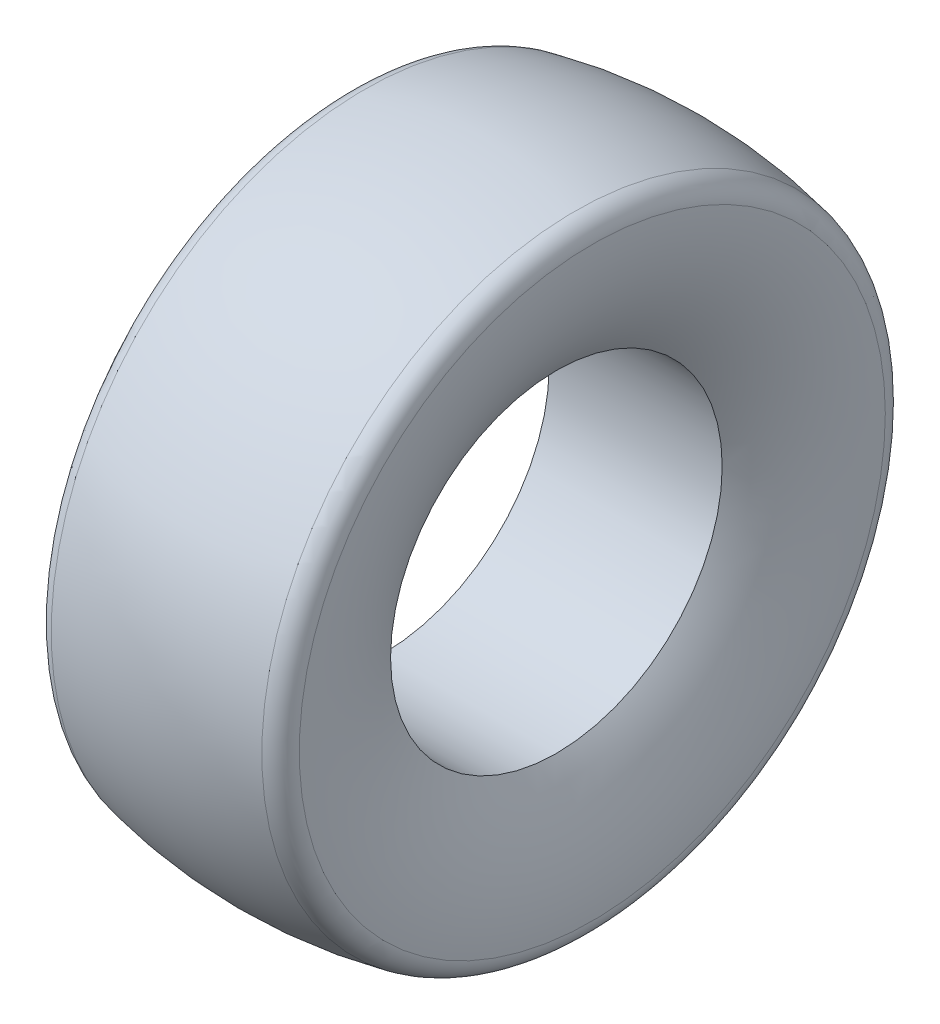
from build123d import *


with BuildPart() as part:
    # Sketch1 → Revolve1 (revolve)
    with BuildSketch(Plane.XY):
        with BuildLine():
            Line((-12, 23), (12, 23))
            ThreePointArc((12, 23), (15.882689243, 31.426850602), (16.978121166, 40.640271016))
            ThreePointArc((16.978121166, 40.640271016), (16.27586038, 42.456648811), (14.606314184, 43.459152682))
            ThreePointArc((14.606314184, 43.459152682), (7.343681374, 44.613722382), (0, 45))
            ThreePointArc((0, 45), (-7.343681374, 44.613722382), (-14.606314184, 43.459152682))
            ThreePointArc((-14.606314184, 43.459152682), (-16.27586038, 42.456648811), (-16.978121166, 40.640271016))
            ThreePointArc((-16.978121166, 40.640271016), (-15.882689243, 31.426850602), (-12, 23))
        make_face()
    revolve(axis=Axis((12, 0, 0), (-1, 0, 0)))


solid = part.part
